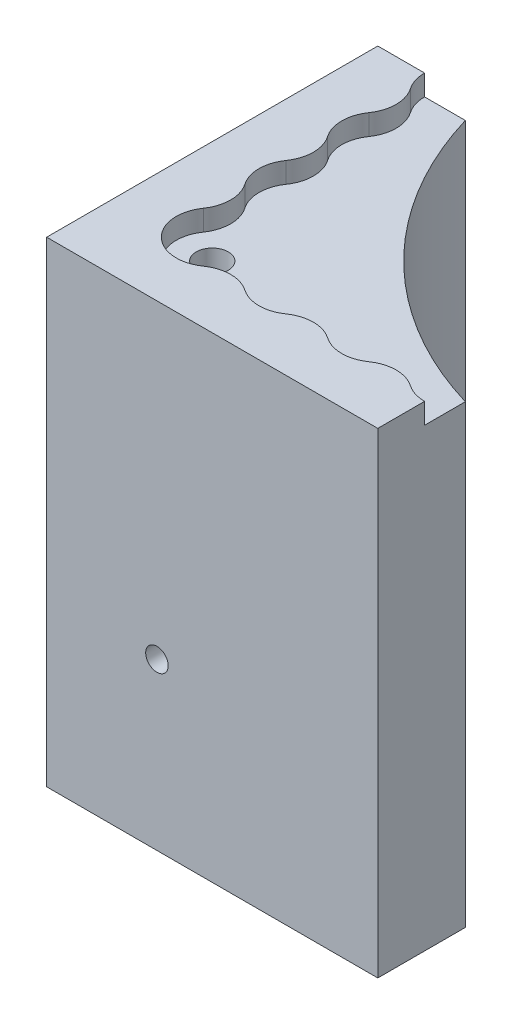
from build123d import *

# Parameters (mm, degrees)
SKETCH1_W                            = 50.8
SKETCH1_H                            = 50.8
BOSS_EXTRUDE1_DEPTH                  = 73.025
CUT_EXTRUDE1_DEPTH                   = 3.175
SKETCH3_R                            = 55.5625
CUT_EXTRUDE2_DEPTH                   = 103.439887861
F_8_32_TAPPED_HOLE1_D                = 3.4544
F_8_32_TAPPED_HOLE1_DEPTH            = 10.70864
F_8_32_TAPPED_HOLE1_TIP              = 1.037806461
F_8_32_TAPPED_HOLE2_D                = 3.4544
F_8_32_TAPPED_HOLE2_DEPTH            = 10.70864
F_8_32_TAPPED_HOLE2_TIP              = 1.037806461
F_10_0_1935_DIAMETER_HOLE1_OUTLINE_R = 2.45745
F_10_0_1935_DIAMETER_HOLE1_DEPTH     = 69.85


# Read off the part's stored shape, not the designer's step: #10 (0.1935) Diameter Hole1
with BuildPart() as part:
    # Sketch1 → Boss-Extrude1 (new body)
    with BuildSketch(Plane(origin=(0, 0, 0), x_dir=(1, 0, 0), z_dir=(0, 1, 0))):
        with Locations((25.4, 25.4)):
            Rectangle(SKETCH1_W, SKETCH1_H)
    extrude(amount=BOSS_EXTRUDE1_DEPTH)

    # Sketch2 → Cut-Extrude1 (cut)
    with BuildSketch(Plane(origin=(0, 73.025, 0), x_dir=(1, 0, 0), z_dir=(0, 1, 0))):
        with BuildLine():
            Line((130.016993909, 125.017737196), (134.25782275, 78.573759143))
            ThreePointArc((134.25782275, 78.573759143), (134.034685181, 75.298190088), (132.798116214, 72.256802214))
            ThreePointArc((132.798116214, 72.256802214), (130.01096738, 66.280890285), (128.580118229, 59.844090402))
            ThreePointArc((128.580118229, 59.844090402), (125.846501332, 47.24207899), (120.576283082, 35.473130329))
            ThreePointArc((120.576283082, 35.473130329), (120.013426501, 34.114565768), (119.824473194, 32.656209898))
            ThreePointArc((119.824473194, 32.656209898), (117.90735564, 28.45485307), (113.469501546, 27.177281171))
            ThreePointArc((113.469501546, 27.177281171), (106.116591491, 23.83727612), (106.198458812, 15.761744078))
            ThreePointArc((106.198458812, 15.761744078), (105.465515747, 8.75311664), (98.443142857, 8.166309094))
            ThreePointArc((98.443142857, 8.166309094), (95.25, 9.168506799), (92.056857143, 8.166309094))
            ThreePointArc((92.056857143, 8.166309094), (88.9, 7.1755), (85.743142857, 8.166309094))
            ThreePointArc((85.743142857, 8.166309094), (82.55, 9.168506799), (79.356857143, 8.166309094))
            ThreePointArc((79.356857143, 8.166309094), (76.212257074, 7.175513597), (73.063291467, 8.152345678))
            ThreePointArc((73.063291467, 8.152345678), (69.907489389, 9.140393728), (66.74574768, 8.171520637))
            ThreePointArc((66.74574768, 8.171520637), (63.508942298, 7.175501389), (60.273525168, 8.176020964))
            ThreePointArc((60.273525168, 8.176020964), (57.10532095, 9.149271709), (53.943097961, 8.156759366))
            ThreePointArc((53.943097961, 8.156759366), (50.791625748, 7.175506347), (47.643142857, 8.166309094))
            ThreePointArc((47.643142857, 8.166309094), (44.45, 9.168506799), (41.256857143, 8.166309094))
            ThreePointArc((41.256857143, 8.166309094), (38.1, 7.1755), (34.943142857, 8.166309094))
            ThreePointArc((34.943142857, 8.166309094), (31.75, 9.168506799), (28.556857143, 8.166309094))
            ThreePointArc((28.556857143, 8.166309094), (25.4, 7.1755), (22.243142857, 8.166309094))
            ThreePointArc((22.243142857, 8.166309094), (19.05, 9.168506799), (15.856857143, 8.166309094))
            ThreePointArc((15.856857143, 8.166309094), (8.793588587, 8.793588587), (8.166309094, 15.856857143))
            ThreePointArc((8.166309094, 15.856857143), (9.168506799, 19.05), (8.166309094, 22.243142857))
            ThreePointArc((8.166309094, 22.243142857), (7.1755, 25.4), (8.166309094, 28.556857143))
            ThreePointArc((8.166309094, 28.556857143), (9.168506799, 31.75), (8.166309094, 34.943142857))
            ThreePointArc((8.166309094, 34.943142857), (7.1755, 38.1), (8.166309094, 41.256857143))
            ThreePointArc((8.166309094, 41.256857143), (9.168506799, 44.45), (8.166309094, 47.643142857))
            ThreePointArc((8.166309094, 47.643142857), (7.175506347, 50.791625748), (8.156759366, 53.943097961))
            ThreePointArc((8.156759366, 53.943097961), (9.149271709, 57.10532095), (8.176020964, 60.273525168))
            ThreePointArc((8.176020964, 60.273525168), (7.175501389, 63.508942298), (8.171520637, 66.74574768))
            ThreePointArc((8.171520637, 66.74574768), (9.140393728, 69.907489389), (8.152345678, 73.063291467))
            ThreePointArc((8.152345678, 73.063291467), (7.175513597, 76.212257074), (8.166309094, 79.356857143))
            ThreePointArc((8.166309094, 79.356857143), (9.168506799, 82.55), (8.166309094, 85.743142857))
            ThreePointArc((8.166309094, 85.743142857), (7.1755, 88.9), (8.166309094, 92.056857143))
            ThreePointArc((8.166309094, 92.056857143), (9.168506799, 95.25), (8.166309094, 98.443142857))
            ThreePointArc((8.166309094, 98.443142857), (8.75311664, 105.465515747), (15.761744078, 106.198458812))
            ThreePointArc((15.761744078, 106.198458812), (23.83727612, 106.116591491), (27.177281171, 113.469501546))
            ThreePointArc((27.177281171, 113.469501546), (28.45485307, 117.90735564), (32.656209898, 119.824473194))
            ThreePointArc((32.656209898, 119.824473194), (34.114565768, 120.013426501), (35.473130329, 120.576283082))
            ThreePointArc((35.473130329, 120.576283082), (47.24207899, 125.846501332), (59.844090402, 128.580118229))
            ThreePointArc((59.844090402, 128.580118229), (68.705211612, 130.952457845), (76.452938417, 135.863689229))
            ThreePointArc((76.452938417, 135.863689229), (80.625736152, 138.0725352), (85.345346996, 138.201045691))
            Line((85.345346996, 138.201045691), (125.626948268, 129.926898817))
            ThreePointArc((125.626948268, 129.926898817), (128.63345164, 128.197989094), (130.016993909, 125.017737196))
        make_face()
    extrude(amount=-CUT_EXTRUDE1_DEPTH, mode=Mode.SUBTRACT)

    # Sketch3 → Cut-Extrude2 (cut, through all)
    with BuildSketch(Plane(origin=(0, 73.025, 0), x_dir=(1, 0, 0), z_dir=(0, 1, 0))):
        with Locations((66.675, 66.675)):
            Circle(SKETCH3_R)
    extrude(amount=-CUT_EXTRUDE2_DEPTH, mode=Mode.SUBTRACT)

    # #8-32 Tapped Hole1
    with Locations(Plane(origin=(393.7, -15.875, 0), x_dir=(1, 0, 0), z_dir=(0, 0, 1))):
        with Locations((-376.782, 41.275)):
            Hole(F_8_32_TAPPED_HOLE1_D / 2, depth=F_8_32_TAPPED_HOLE1_DEPTH)
            with Locations((0, 0, -(F_8_32_TAPPED_HOLE1_DEPTH + F_8_32_TAPPED_HOLE1_TIP / 2))):  # 118° drill point
                Cone(0, F_8_32_TAPPED_HOLE1_D / 2, F_8_32_TAPPED_HOLE1_TIP, mode=Mode.SUBTRACT)

    # #8-32 Tapped Hole2
    with Locations(Plane(origin=(0, -15.875, -393.7), x_dir=(0, 0, 1), z_dir=(-1, 0, 0))):
        with Locations((374.968, 41.275)):
            Hole(F_8_32_TAPPED_HOLE2_D / 2, depth=F_8_32_TAPPED_HOLE2_DEPTH)
            with Locations((0, 0, -(F_8_32_TAPPED_HOLE2_DEPTH + F_8_32_TAPPED_HOLE2_TIP / 2))):  # 118° drill point
                Cone(0, F_8_32_TAPPED_HOLE2_D / 2, F_8_32_TAPPED_HOLE2_TIP, mode=Mode.SUBTRACT)

    # #10 (0.1935) Diameter Hole1 outline → #10 (0.1935) Diameter Hole1 (cut)
    with BuildSketch(Plane(origin=(0, 0, 0), x_dir=(1, 0, 0), z_dir=(0, 1, 0))):
        with Locations((12.7, 12.7)):
            Circle(F_10_0_1935_DIAMETER_HOLE1_OUTLINE_R)
    extrude(amount=F_10_0_1935_DIAMETER_HOLE1_DEPTH, mode=Mode.SUBTRACT)


solid = part.part
